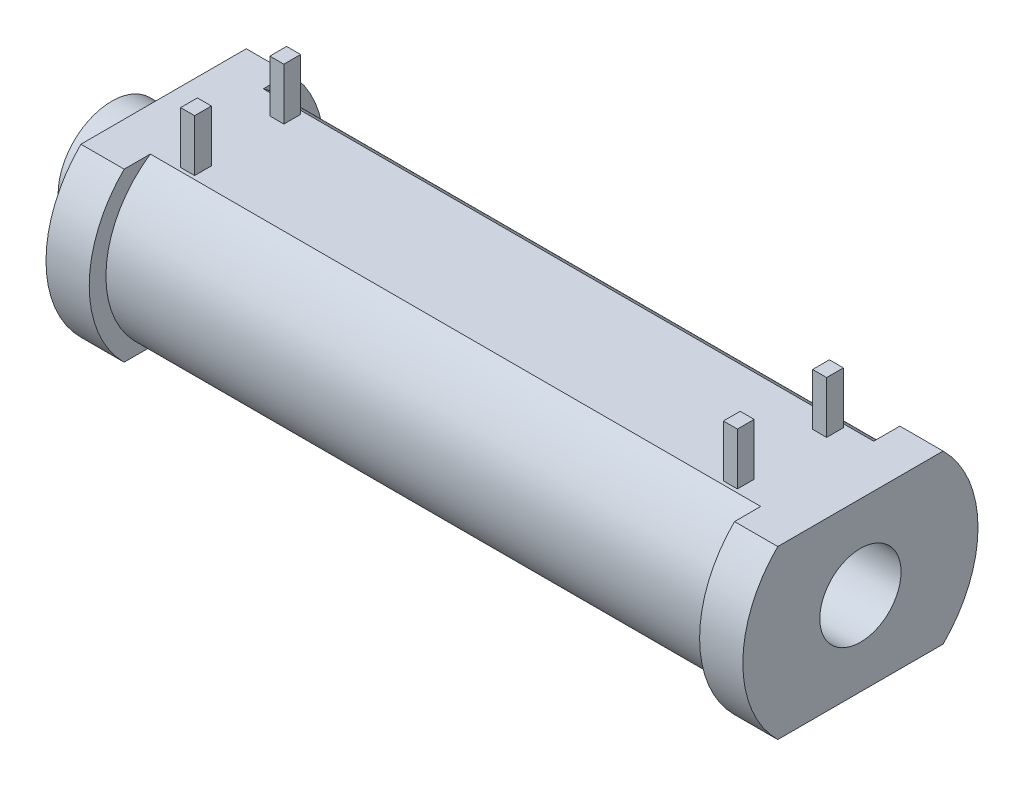
from build123d import *

# Parameters (mm, degrees)
CUT_EXTRUDE1_REACH      = 43.432
SKETCH3_R               = 2.35
CUT_EXTRUDE2_DEPTH      = 23.327169547
CUT_EXTRUDE2_DEPTH_BACK = 23.327169547
SKETCH4_W               = 50.979880504
SKETCH4_H               = 2
SKETCH4_W_2             = 55.035186208
SKETCH5_W               = 0.81
SKETCH5_H               = 0.97
BOSS_EXTRUDE1_DEPTH     = 3
BOSS_EXTRUDE2_START     = 3
SKETCH6_R               = 3.1
SKETCH6_R_2             = 2.35
BOSS_EXTRUDE2_DEPTH     = 3
FILLET1_R               = 1


with BuildPart() as part:
    # Sketch2 → Revolve1 (revolve)
    with BuildSketch(Plane(origin=(0, 0, 0), x_dir=(1, 0, 0), z_dir=(0, 1, 0))):
        Polygon((-17.65, 5.835), (17.65, 5.835), (17.65, 6.8), (20.15, 6.8), (20.15, 0), (-20.15, 0), (-20.15, 6.8), (-17.65, 6.8), align=None)
    revolve(axis=Axis((20.15, 0, 0), (-1, 0, 0)))

    # Sketch3 → Cut-Extrude1 (cut, up to next)
    with BuildSketch(Plane.ZY.offset(20.15), mode=Mode.PRIVATE) as cut_extrude1_sk1:
        Circle(SKETCH3_R)
    cut_extrude1_tool1 = extrude(cut_extrude1_sk1.sketch, amount=-CUT_EXTRUDE1_REACH, mode=Mode.PRIVATE) & part.part
    add(cut_extrude1_tool1.solids().sort_by_distance((-20.15, 0, 0))[0], mode=Mode.SUBTRACT)

    # Sketch4 → Cut-Extrude2 (cut, two sides: drawn at the far end of the back side and taken through both)
    with BuildSketch(Plane.XY.offset(-CUT_EXTRUDE2_DEPTH_BACK)):
        with Locations((0, 5.835)):
            Rectangle(SKETCH4_W, SKETCH4_H)
        with Locations((0, -5.835)):
            Rectangle(SKETCH4_W_2, SKETCH4_H)
    extrude(amount=CUT_EXTRUDE2_DEPTH + CUT_EXTRUDE2_DEPTH_BACK, mode=Mode.SUBTRACT)

    # Sketch5 → Boss-Extrude1 (add)
    with BuildSketch(Plane(origin=(0, 4.835, 0), x_dir=(1, 0, 0), z_dir=(0, 1, 0))):
        with Locations((-15.695, -2.579969555)):
            Rectangle(SKETCH5_W, SKETCH5_H)
        with Locations((15.695, -2.579969555)):
            Rectangle(SKETCH5_W, SKETCH5_H)
        with Locations((15.695, 2.579969555)):
            Rectangle(SKETCH5_W, SKETCH5_H)
        with Locations((-15.695, 2.579969555)):
            Rectangle(SKETCH5_W, SKETCH5_H)
    extrude(amount=BOSS_EXTRUDE1_DEPTH)

    # Sketch6 → Boss-Extrude2 (add)
    with BuildSketch(Plane.ZY.offset(20.15).offset(BOSS_EXTRUDE2_START)):
        Circle(SKETCH6_R)
        Circle(SKETCH6_R_2, mode=Mode.SUBTRACT)
    extrude(amount=-BOSS_EXTRUDE2_DEPTH)

    # Fillet1
    fillet1_edges = [part.edges().sort_by_distance(p)[0] for p in [
        (-20.15, 0, -3.1),
    ]]
    fillet(fillet1_edges, radius=FILLET1_R)


solid = part.part
